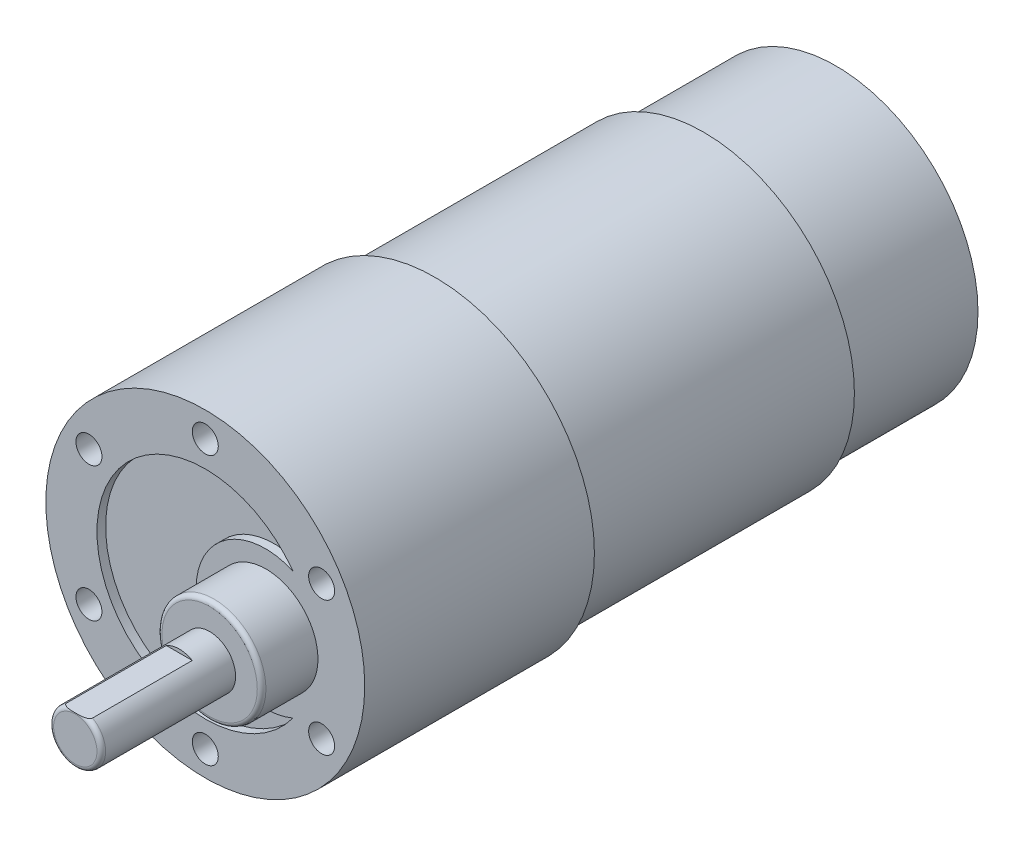
from build123d import *

# Parameters (mm, degrees)
SKETCH1_R                    = 18.4
BOSS_EXTRUDE1_DEPTH          = 26.5
SKETCH2_R                    = 17.4
BOSS_EXTRUDE2_DEPTH          = 31
SKETCH3_R                    = 6
BOSS_EXTRUDE3_DEPTH          = 6.5
FILLET1_R                    = 0.5
SKETCH4_R                    = 3
BOSS_EXTRUDE4_DEPTH          = 15.5
CUT_EXTRUDE1_START           = -12
CUT_EXTRUDE1_DEPTH           = 12
F_3_0_3_DIAMETER_HOLE1_D     = 3
F_3_0_3_DIAMETER_HOLE1_DEPTH = 3
F_3_0_3_DIAMETER_HOLE1_TIP   = 0.901290929
CUT_EXTRUDE2_DEPTH           = 1
SKETCH9_R                    = 4
BOSS_EXTRUDE5_DEPTH          = 1
FILLET2_R                    = 0.5
SKETCH10_R                   = 14
BOSS_EXTRUDE6_DEPTH          = 1.5
SKETCH11_W                   = 3.5
SKETCH11_H                   = 1
BOSS_EXTRUDE7_DEPTH          = 5.6
FILLET3_R                    = 0.5
SKETCH13_R                   = 9
BOSS_EXTRUDE8_DEPTH          = 3
SKETCH14_R                   = 1.5
BOSS_EXTRUDE9_DEPTH          = 8.55
FILLET4_R                    = 0.5
SKETCH15_R                   = 16.4
BOSS_EXTRUDE10_DEPTH         = 15.26


with BuildPart() as part:
    # Sketch1 → Boss-Extrude1 (new body)
    with BuildSketch(Plane.XY):
        Circle(SKETCH1_R)
    extrude(amount=BOSS_EXTRUDE1_DEPTH)

    # Sketch2 → Boss-Extrude2 (add)
    with BuildSketch(Plane(origin=(0, 0, 0), x_dir=(-1, 0, 0), z_dir=(0, 0, -1))):
        with Locations(Location((0, 0, 0), (0, 0, 180))):
            Circle(SKETCH2_R)
    extrude(amount=BOSS_EXTRUDE2_DEPTH)

    # Sketch3 → Boss-Extrude3 (add)
    with BuildSketch(Plane.XY.offset(26.5)):
        with Locations(Location((7, 0, 0), (0, 0, 180))):
            Circle(SKETCH3_R)
    extrude(amount=BOSS_EXTRUDE3_DEPTH)

    # Fillet1
    fillet1_edges = [part.edges().sort_by_distance(p)[0] for p in [
        (13, 0, 33),
    ]]
    fillet(fillet1_edges, radius=FILLET1_R)

    # Sketch4 → Boss-Extrude4 (add)
    with BuildSketch(Plane.XY.offset(33)):
        with Locations((7, 0)):
            Circle(SKETCH4_R)
    extrude(amount=BOSS_EXTRUDE4_DEPTH)

    # Sketch5 → Cut-Extrude1 (cut)
    with BuildSketch(Plane.XY.offset(48.5).offset(CUT_EXTRUDE1_START)):
        with BuildLine():
            Line((5.503337045, 2.6), (8.496662955, 2.6))
            ThreePointArc((8.496662955, 2.6), (7, 3), (5.503337045, 2.6))
        make_face()
    extrude(amount=CUT_EXTRUDE1_DEPTH, mode=Mode.SUBTRACT)

    # Ø3.0 (3) Diameter Hole1
    with Locations(Plane.XY.offset(26.5)):
        with Locations((-13.423393759, 7.75), (-13.423393759, -7.75), (0, -15.5), (13.423393759, 7.75), (0, 15.5), (13.423393759, -7.75)):
            Hole(F_3_0_3_DIAMETER_HOLE1_D / 2, depth=F_3_0_3_DIAMETER_HOLE1_DEPTH)
            with Locations((0, 0, -(F_3_0_3_DIAMETER_HOLE1_DEPTH + F_3_0_3_DIAMETER_HOLE1_TIP / 2))):  # 118° drill point
                Cone(0, F_3_0_3_DIAMETER_HOLE1_D / 2, F_3_0_3_DIAMETER_HOLE1_TIP, mode=Mode.SUBTRACT)

    # Sketch8 → Cut-Extrude2 (cut)
    with BuildSketch(Plane.XY.offset(26.5)):
        with BuildLine():
            ThreePointArc((10.116155685, 7.342574083), (-12.5, 0), (10.116155685, -7.342574083))
            ThreePointArc((10.116155685, -7.342574083), (-1.05978604, 0), (10.116155685, 7.342574083))
        make_face()
    extrude(amount=-CUT_EXTRUDE2_DEPTH, mode=Mode.SUBTRACT)

    # Sketch9 → Boss-Extrude5 (add)
    with BuildSketch(Plane(origin=(0, 0, -31), x_dir=(-1, 0, 0), z_dir=(0, 0, -1))):
        Circle(SKETCH9_R)
    extrude(amount=BOSS_EXTRUDE5_DEPTH)

    # Fillet2
    fillet2_edges = [part.edges().sort_by_distance(p)[0] for p in [
        (4, 0, -32),
    ]]
    fillet(fillet2_edges, radius=FILLET2_R)

    # Sketch11 → Boss-Extrude7 (add)
    with BuildSketch(Plane(origin=(0, 0, -31), x_dir=(-1, 0, 0), z_dir=(0, 0, -1))):
        with Locations((0, 12.05)):
            Rectangle(SKETCH11_W, SKETCH11_H)
        with Locations((0, -12.05)):
            Rectangle(SKETCH11_W, SKETCH11_H)
    extrude(amount=BOSS_EXTRUDE7_DEPTH)

    # Fillet3
    fillet3_edges = [part.edges().sort_by_distance(p)[0] for p in [
        (1.75, 12.05, -36.6),
        (-1.75, 12.05, -36.6),
        (-1.75, -12.05, -36.6),
        (1.75, -12.05, -36.6),
    ]]
    fillet(fillet3_edges, radius=FILLET3_R)

    # Sketch14 → Boss-Extrude9 (add)
    with BuildSketch(Plane(origin=(0, 0, -32), x_dir=(-1, 0, 0), z_dir=(0, 0, -1))):
        Circle(SKETCH14_R)
    extrude(amount=BOSS_EXTRUDE9_DEPTH)

    # Fillet4
    # the kernel refuses this fillet: 0.5 mm, written as the material it takes off along each edge
    with BuildSketch(Plane(origin=(7, 0, 48.5), x_dir=(0.4622655728594592, 0.8867415295050277, 0), z_dir=(0.8867415295050277, -0.4622655728594592, 0))) as fillet4_piece_1:
        with BuildLine():
            CenterArc((3 - FILLET4_R, -FILLET4_R), FILLET4_R, 0, 90)
            Line((3 - FILLET4_R, 0), (3 - FILLET4_R, FILLET4_R * 0.02))
            Line((3 - FILLET4_R, FILLET4_R * 0.02), (3 + FILLET4_R * 0.02, FILLET4_R * 0.02))
            Line((3 + FILLET4_R * 0.02, FILLET4_R * 0.02), (3 + FILLET4_R * 0.02, -FILLET4_R))
            Line((3 + FILLET4_R * 0.02, -FILLET4_R), (3, -FILLET4_R))
        make_face()
    revolve(axis=Axis((7, 0, 48.5), (0, 0, 1)), revolution_arc=297.533397677, mode=Mode.SUBTRACT)
    with BuildSketch(Plane(origin=(7, 0, 48.5), x_dir=(1, 0, 0), z_dir=(0, -1, 0))) as fillet4_piece_2:
        with BuildLine():
            CenterArc((3 - FILLET4_R, -FILLET4_R), FILLET4_R, 0, 90)
            Line((3 - FILLET4_R, 0), (3 - FILLET4_R, FILLET4_R * 0.02))
            Line((3 - FILLET4_R, FILLET4_R * 0.02), (3 + FILLET4_R * 0.02, FILLET4_R * 0.02))
            Line((3 + FILLET4_R * 0.02, FILLET4_R * 0.02), (3 + FILLET4_R * 0.02, -FILLET4_R))
            Line((3 + FILLET4_R * 0.02, -FILLET4_R), (3, -FILLET4_R))
        make_face()
    revolve(axis=Axis((7, 0, 48.5), (0, 0, 1)), revolution_arc=117.379597562, mode=Mode.SUBTRACT)



with BuildPart() as body_2:
    # Sketch10 → Boss-Extrude6 (new body)
    with BuildSketch(Plane(origin=(0, 0, -34), x_dir=(-1, 0, 0), z_dir=(0, 0, -1))):
        Circle(SKETCH10_R)
    extrude(amount=BOSS_EXTRUDE6_DEPTH)


with BuildPart() as body_3:
    # Sketch13 → Boss-Extrude8 (new body)
    with BuildSketch(Plane(origin=(0, 0, -37.5), x_dir=(-1, 0, 0), z_dir=(0, 0, -1))):
        Circle(SKETCH13_R)
    extrude(amount=BOSS_EXTRUDE8_DEPTH)


with BuildPart() as part_1:
    add(part.part)

    add(body_2.part)  # Boss-Extrude10 merges body 2

    add(body_3.part)  # Boss-Extrude10 merges body 3
    # Sketch15 → Boss-Extrude10 (add)
    with BuildSketch(Plane(origin=(0, 0, -31), x_dir=(-1, 0, 0), z_dir=(0, 0, -1))):
        Circle(SKETCH15_R)
    extrude(amount=BOSS_EXTRUDE10_DEPTH)


solid = part_1.part
